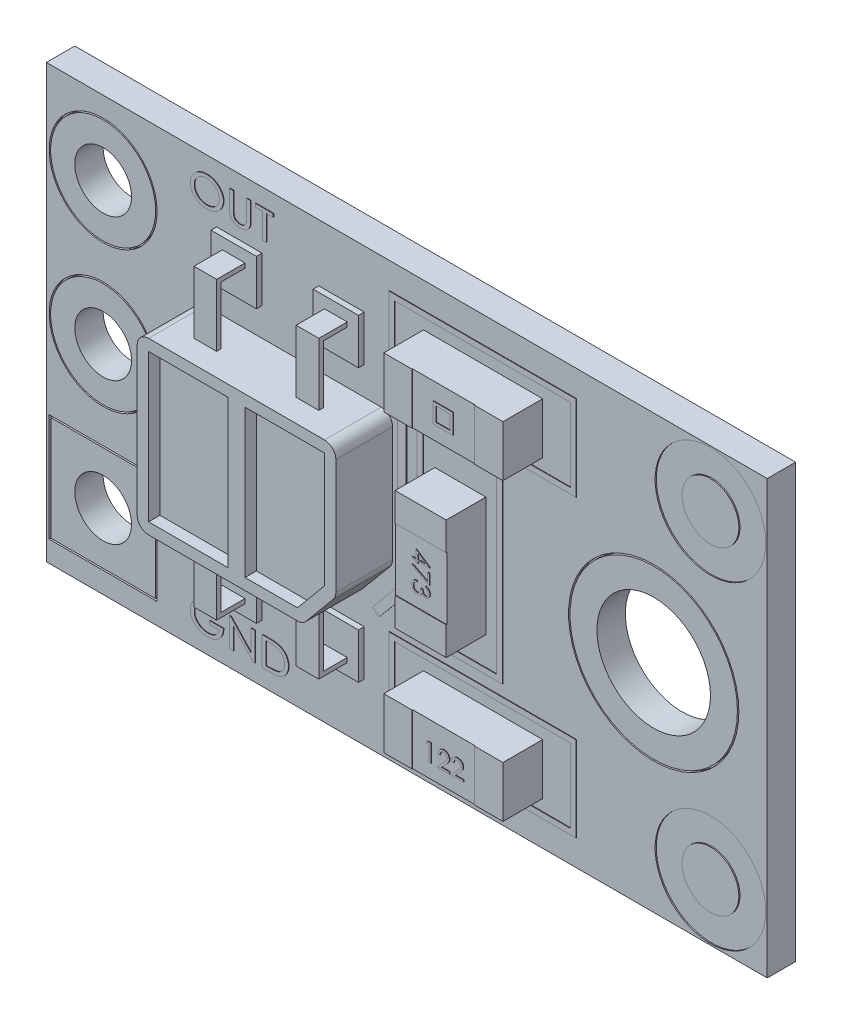
from build123d import *

# Parameters (mm, degrees)
CROQUIS1_W               = 12.7
CROQUIS1_H               = 7.62
SALIENTE_EXTRUIR1_DEPTH  = 0.25
CROQUIS2_R               = 0.95
CROQUIS2_R_2             = 0.925
CROQUIS2_W               = 1.9
CROQUIS2_H               = 1.9
CROQUIS2_W_2             = 1.84
CROQUIS2_H_2             = 1.84
CORTAR_EXTRUIR6_DEPTH    = 0.05
CROQUIS3_R               = 0.5
CORTAR_EXTRUIR7_DEPTH    = 50.05
CROQUIS4_R               = 1.5
CROQUIS4_R_2             = 1.475
CORTAR_EXTRUIR8_DEPTH    = 0.05
CROQUIS5_R               = 1
CORTAR_EXTRUIR9_DEPTH    = 40.05
CROQUIS6_R               = 0.975
CROQUIS6_R_2             = 0.5
CORTAR_EXTRUIR10_DEPTH   = 0.02
SALIENTE_EXTRUIR2_DEPTH  = 0.01
CROQUIS8_W               = 1.5
CROQUIS8_H               = 3.3
CROQUIS8_W_2             = 1.3
CROQUIS8_H_2             = 3.1
CROQUIS8_W_3             = 3.3
CROQUIS8_H_3             = 1.5
CROQUIS8_W_4             = 3.1
CROQUIS8_H_4             = 1.3
SALIENTE_EXTRUIR3_DEPTH  = 0.01
CROQUIS9_W               = 0.5
CROQUIS9_H               = 0.07051282
SALIENTE_EXTRUIR4_DEPTH  = 0.01
SALIENTE_EXTRUIR5_DEPTH  = 1
CROQUIS12_W              = 1.4
CROQUIS12_H              = 2.6
CORTAR_EXTRUIR11_DEPTH   = 0.2
CROQUIS13_W              = 0.8
CROQUIS13_H              = 0.8
SALIENTE_EXTRUIR6_DEPTH  = 0.1
CROQUIS14_W              = 0.4
CROQUIS14_H              = 1.1
SALIENTE_EXTRUIR7_DEPTH  = 0.5
CROQUIS15_W              = 0.42
CROQUIS15_H              = 1.02
CORTAR_EXTRUIR12_DEPTH   = 20.5
CORTAR_EXTRUIR13_DEPTH   = 11
SALIENTE_EXTRUIR8_DEPTH  = 0.01
CROQUIS18_W              = 2.1
CROQUIS18_H              = 0.9
CROQUIS18_W_2            = 0.9
CROQUIS18_H_2            = 2.1
SALIENTE_EXTRUIR9_DEPTH  = 0.7
CROQUIS19_W              = 1.1
CROQUIS19_H              = 0.9
CROQUIS19_W_2            = 0.9
CROQUIS19_H_2            = 1.1
CORTAR_EXTRUIR14_DEPTH   = 0.01
CROQUIS20_W              = 0.35
CROQUIS20_H              = 0.35
CROQUIS20_W_2            = 0.25
CROQUIS20_H_2            = 0.25
SALIENTE_EXTRUIR10_DEPTH = 0.01


with BuildPart() as part:
    # Croquis1 → Saliente-Extruir1 (new, symmetric)
    with BuildSketch(Plane.XY):
        Rectangle(CROQUIS1_W, CROQUIS1_H)
    extrude(amount=SALIENTE_EXTRUIR1_DEPTH, both=True)

    # Croquis2 → Cortar-Extruir6 (cut)
    # profile 1 of 3: a face of its own
    with BuildSketch(Plane.XY.offset(0.25)):
        with Locations((-5.35, 2.51)):
            Circle(CROQUIS2_R)
        with Locations((-5.35, 2.51)):
            Circle(CROQUIS2_R_2, mode=Mode.SUBTRACT)
    # profile 2 of 3: a face of its own
    with BuildSketch(Plane.XY.offset(0.25)):
        with Locations((-5.35, 0.01)):
            Circle(CROQUIS2_R)
        with Locations((-5.35, 0.01)):
            Circle(CROQUIS2_R_2, mode=Mode.SUBTRACT)
    # profile 3 of 3: a face of its own
    with BuildSketch(Plane.XY.offset(0.25)):
        with Locations((-5.35, -2.49)):
            Rectangle(CROQUIS2_W, CROQUIS2_H)
        with Locations((-5.35, -2.49)):
            Rectangle(CROQUIS2_W_2, CROQUIS2_H_2, mode=Mode.SUBTRACT)
    extrude(amount=-CORTAR_EXTRUIR6_DEPTH, mode=Mode.SUBTRACT)

    # Croquis3 → Cortar-Extruir7 (cut)
    with BuildSketch(Plane.XY.offset(0.25)):
        with Locations((-5.35, 2.51)):
            Circle(CROQUIS3_R)
        with Locations((-5.35, 0.01)):
            Circle(CROQUIS3_R)
        with Locations((-5.35, -2.49)):
            Circle(CROQUIS3_R)
    extrude(amount=-CORTAR_EXTRUIR7_DEPTH, mode=Mode.SUBTRACT)

    # Croquis4 → Cortar-Extruir8 (cut)
    with BuildSketch(Plane.XY.offset(0.25)):
        with Locations((4.35, 0)):
            Circle(CROQUIS4_R)
        with Locations((4.35, 0)):
            Circle(CROQUIS4_R_2, mode=Mode.SUBTRACT)
    extrude(amount=-CORTAR_EXTRUIR8_DEPTH, mode=Mode.SUBTRACT)

    # Croquis5 → Cortar-Extruir9 (cut)
    with BuildSketch(Plane.XY.offset(0.25)):
        with Locations((4.35, 0)):
            Circle(CROQUIS5_R)
    extrude(amount=-CORTAR_EXTRUIR9_DEPTH, mode=Mode.SUBTRACT)

    # Croquis6 → Cortar-Extruir10 (cut)
    # profile 1 of 2: a face of its own
    with BuildSketch(Plane.XY.offset(0.25)):
        with Locations((5.35, 2.81)):
            Circle(CROQUIS6_R)
        with Locations((5.35, 2.81)):
            Circle(CROQUIS6_R_2, mode=Mode.SUBTRACT)
    # profile 2 of 2: a face of its own
    with BuildSketch(Plane.XY.offset(0.25)):
        with Locations((5.35, -2.81)):
            Circle(CROQUIS6_R)
        with Locations((5.35, -2.81)):
            Circle(CROQUIS6_R_2, mode=Mode.SUBTRACT)
    extrude(amount=-CORTAR_EXTRUIR10_DEPTH, mode=Mode.SUBTRACT)

    # Croquis7 → Saliente-Extruir2 (add)
    # profile 1 of 6: a face of its own
    with BuildSketch(Plane.XY.offset(0.25)):
        with BuildLine():
            add(Edge.make_bspline(
                [(-3.520172276, 3.522820513), (-3.50971154, 3.522598173), (-3.489160024, 3.522161356), (-3.459031652, 3.518472078), (-3.430231343, 3.512494951), (-3.402761056, 3.504058656), (-3.376615169, 3.493227871), (-3.351848687, 3.479947049), (-3.328492632, 3.464208365), (-3.306723615, 3.446297148), (-3.286960401, 3.426706399), (-3.269421641, 3.406034569), (-3.25476033, 3.384158429), (-3.242579274, 3.361360499), (-3.233408402, 3.337427268), (-3.226603451, 3.312624136), (-3.222500209, 3.286746012), (-3.222032121, 3.269129296), (-3.221794872, 3.260200321)],
                knots=[0, 0, 0, 0, 1.133622203, 2.227152804, 3.28475862, 4.318496009, 5.33742298, 6.347804203, 7.359610414, 8.385564043, 9.398987128, 10.372561984, 11.319123818, 12.248396799, 13.168490851, 14.091228938, 15.032545622, 16, 16, 16, 16], degree=3))
            add(Edge.make_bspline(
                [(-3.221794872, 3.260200321), (-3.222029757, 3.251337084), (-3.222494027, 3.233818145), (-3.226651471, 3.208064917), (-3.233267753, 3.183251641), (-3.242514208, 3.159375085), (-3.254523639, 3.136503106), (-3.269296046, 3.114685908), (-3.28660546, 3.093793202), (-3.306323166, 3.074109304), (-3.327974371, 3.056129386), (-3.351071107, 3.040286787), (-3.375507428, 3.027027028), (-3.40112041, 3.016001054), (-3.428080221, 3.007676688), (-3.456172473, 3.001494424), (-3.485554041, 2.997847625), (-3.505572104, 2.997404914), (-3.515765224, 2.997179487)],
                knots=[0, 0, 0, 0, 0.968800078, 1.914915397, 2.844941176, 3.773252184, 4.70912315, 5.664138313, 6.649680364, 7.672140846, 8.70676723, 9.723611496, 10.730169601, 11.742789494, 12.768322859, 13.811145079, 14.885443574, 16, 16, 16, 16], degree=3))
            add(Edge.make_bspline(
                [(-3.515765224, 2.997179487), (-3.525724241, 2.997413848), (-3.545304747, 2.997874627), (-3.574084184, 3.001406533), (-3.601629768, 3.00743898), (-3.628009942, 3.015796861), (-3.653301132, 3.02638634), (-3.677291033, 3.03962559), (-3.700160992, 3.055105428), (-3.721503373, 3.072840425), (-3.741015174, 3.092187912), (-3.758160167, 3.112793702), (-3.772714212, 3.134448332), (-3.784594775, 3.157147083), (-3.793764068, 3.180921948), (-3.800393009, 3.205619194), (-3.804407624, 3.231389723), (-3.804885474, 3.248901232), (-3.805128205, 3.257796474)],
                knots=[0, 0, 0, 0, 1.102646875, 2.167923352, 3.20494899, 4.221049628, 5.228395391, 6.236046417, 7.250208059, 8.282166416, 9.304356202, 10.288974788, 11.245682606, 12.188277397, 13.119976628, 14.061642868, 15.015381414, 16, 16, 16, 16], degree=3))
            add(Edge.make_bspline(
                [(-3.805128205, 3.257796474), (-3.805014375, 3.263777111), (-3.804788735, 3.275632287), (-3.802931162, 3.293240191), (-3.799891156, 3.310490611), (-3.795864292, 3.327469908), (-3.790343559, 3.344018828), (-3.78388376, 3.360337456), (-3.77600699, 3.376215078), (-3.767147688, 3.391750533), (-3.757124641, 3.40658408), (-3.746307223, 3.420778205), (-3.734548661, 3.434120204), (-3.721931344, 3.446670338), (-3.708384605, 3.458290565), (-3.693956112, 3.469035927), (-3.678777501, 3.479071184), (-3.662741757, 3.488118586), (-3.646211421, 3.496376929), (-3.629122437, 3.503322609), (-3.611792545, 3.50938528), (-3.594094839, 3.514302776), (-3.57606239, 3.518117039), (-3.557691588, 3.520763819), (-3.539039348, 3.522592307), (-3.526486804, 3.522744136), (-3.520172276, 3.522820513)],
                knots=[0, 0, 0, 0, 0.994681255, 1.971716819, 2.941384761, 3.907196137, 4.87139339, 5.840822735, 6.824402777, 7.817050853, 8.813652822, 9.80005115, 10.783835005, 11.769545163, 12.758067534, 13.749969586, 14.760448599, 15.782717554, 16.810988271, 17.832034514, 18.848979272, 19.863616308, 20.885326922, 21.912667335, 22.949972225, 24, 24, 24, 24], degree=3))
        make_face()
        with BuildLine():
            add(Edge.make_bspline(
                [(-3.517768429, 3.465128205), (-3.522412525, 3.465061381), (-3.531652552, 3.464928426), (-3.545429057, 3.463542828), (-3.559041557, 3.46146065), (-3.572534025, 3.458560253), (-3.585834523, 3.454732508), (-3.598977877, 3.450118678), (-3.611965851, 3.444690575), (-3.624668433, 3.438422307), (-3.637003376, 3.431438793), (-3.648708119, 3.423690827), (-3.659844033, 3.415440669), (-3.670190695, 3.406436162), (-3.679965203, 3.39690823), (-3.689058006, 3.386693772), (-3.697528675, 3.375844567), (-3.705164615, 3.364360617), (-3.712149891, 3.352431115), (-3.718105194, 3.340012215), (-3.723273272, 3.327289857), (-3.727355639, 3.314136342), (-3.730694721, 3.300672647), (-3.732998401, 3.286775823), (-3.734281972, 3.272511061), (-3.734503354, 3.26287374), (-3.734615385, 3.257996795)],
                knots=[0, 0, 0, 0, 1.001886696, 1.99338304, 2.984853206, 3.972651636, 4.969239506, 5.969570638, 6.977140523, 8.005010729, 9.024666764, 10.033806776, 11.032397997, 12.013155796, 12.991369748, 13.976220934, 14.96199408, 15.959128717, 16.950206134, 17.942696722, 18.928733127, 19.910839666, 20.912130348, 21.920112307, 22.947477366, 24, 24, 24, 24], degree=3))
            add(Edge.make_bspline(
                [(-3.734615385, 3.257996795), (-3.734431743, 3.250840917), (-3.73407135, 3.236797695), (-3.730971625, 3.216220213), (-3.725983488, 3.196569954), (-3.718922735, 3.177828606), (-3.709868057, 3.159961463), (-3.698670805, 3.1431187), (-3.685544966, 3.127180243), (-3.670602405, 3.112404306), (-3.6543007, 3.098965944), (-3.636992754, 3.087238002), (-3.619032059, 3.077095592), (-3.600202778, 3.069003042), (-3.580661262, 3.062631931), (-3.560365426, 3.058165735), (-3.539314361, 3.055366958), (-3.525022212, 3.0550385), (-3.517768429, 3.054871795)],
                knots=[0, 0, 0, 0, 1.03727934, 2.035633217, 3.010330647, 3.972573882, 4.934000609, 5.908938527, 6.899607749, 7.923294137, 8.95177844, 9.958980979, 10.951742254, 11.938451676, 12.926051656, 13.928073702, 14.948422591, 16, 16, 16, 16], degree=3))
            add(Edge.make_bspline(
                [(-3.517768429, 3.054871795), (-3.51265703, 3.054937433), (-3.502517389, 3.05506764), (-3.487475347, 3.056455339), (-3.472710433, 3.058488805), (-3.458294702, 3.061581363), (-3.444064937, 3.065209576), (-3.430207942, 3.069954736), (-3.416637625, 3.075486417), (-3.403429882, 3.081752536), (-3.390760614, 3.088884641), (-3.378648739, 3.09654864), (-3.367251324, 3.104856042), (-3.356776214, 3.113973731), (-3.346757974, 3.12342389), (-3.337669287, 3.133712971), (-3.329224504, 3.144542491), (-3.321529628, 3.155953761), (-3.314606658, 3.167804065), (-3.308735862, 3.180109199), (-3.303528435, 3.192632527), (-3.299489479, 3.205560506), (-3.296241595, 3.218768392), (-3.293918863, 3.232320021), (-3.29264908, 3.246220296), (-3.292421888, 3.255590594), (-3.292307692, 3.260300481)],
                knots=[0, 0, 0, 0, 1.081838315, 2.146076261, 3.195683593, 4.235390777, 5.265781704, 6.302938874, 7.333329801, 8.367181877, 9.395631416, 10.409402045, 11.400444419, 12.377959082, 13.347802418, 14.314007038, 15.281116162, 16.253506205, 17.225819172, 18.183714434, 19.137977778, 20.09475097, 21.047940386, 22.015927363, 23.002725858, 24, 24, 24, 24], degree=3))
            add(Edge.make_bspline(
                [(-3.292307692, 3.260300481), (-3.292421537, 3.264976911), (-3.292647216, 3.27424719), (-3.293912646, 3.287983114), (-3.296275307, 3.301391298), (-3.299432116, 3.314457614), (-3.303578389, 3.327219105), (-3.308708834, 3.339569911), (-3.314607708, 3.351700345), (-3.321566679, 3.363356931), (-3.32918735, 3.374679387), (-3.33779777, 3.385306825), (-3.347029848, 3.39543704), (-3.356910349, 3.405108018), (-3.367731652, 3.414019929), (-3.379227924, 3.42242733), (-3.391492974, 3.430276639), (-3.404439295, 3.437401461), (-3.417835446, 3.44390773), (-3.431483789, 3.449650234), (-3.445421546, 3.454287684), (-3.459439746, 3.458428126), (-3.473765956, 3.461326817), (-3.488262665, 3.463591301), (-3.502953155, 3.464914359), (-3.512824658, 3.465056846), (-3.517768429, 3.465128205)],
                knots=[0, 0, 0, 0, 0.994155032, 1.970754174, 2.928608866, 3.885595639, 4.825912961, 5.777410987, 6.726365038, 7.690299412, 8.660690635, 9.624912318, 10.594446844, 11.573080812, 12.560755883, 13.571390023, 14.598998756, 15.653599689, 16.710514158, 17.763538028, 18.798106891, 19.831384962, 20.868287771, 21.902053123, 22.949322197, 24, 24, 24, 24], degree=3))
        make_face(mode=Mode.SUBTRACT)
    # profile 2 of 6: a face of its own
    with BuildSketch(Plane.XY.offset(0.25)):
        with BuildLine():
            Line((-3.112820513, 3.51), (-3.042307692, 3.51))
            Line((-3.042307692, 3.51), (-3.042307692, 3.208116987))
            add(Edge.make_bspline(
                [(-3.042307692, 3.208116987), (-3.04231412, 3.203943659), (-3.042326359, 3.195997494), (-3.042244696, 3.184745136), (-3.042004533, 3.174763739), (-3.041855848, 3.16604722), (-3.041527483, 3.158603143), (-3.041252621, 3.152423929), (-3.040909453, 3.147537959), (-3.040484931, 3.144713965), (-3.040304487, 3.143513622)],
                knots=[0, 0, 0, 0, 1.548731127, 2.948838887, 4.175684214, 5.253885865, 6.183867635, 6.940561878, 7.549683953, 8, 8, 8, 8], degree=3))
            add(Edge.make_bspline(
                [(-3.040304487, 3.143513622), (-3.039556638, 3.138845524), (-3.038116301, 3.129854888), (-3.034087212, 3.117256574), (-3.029188695, 3.105928095), (-3.022819106, 3.095969631), (-3.015013741, 3.087113314), (-3.005482179, 3.079378002), (-2.994427043, 3.072258665), (-2.981868317, 3.066253509), (-2.968539853, 3.061204128), (-2.954879114, 3.057587805), (-2.941226326, 3.055256339), (-2.932073784, 3.05499948), (-2.927524038, 3.054871795)],
                knots=[0, 0, 0, 0, 1.076166962, 2.072670033, 3.006093884, 3.882195196, 4.755615117, 5.685184141, 6.671023493, 7.746544464, 8.851914234, 9.915195746, 10.96363998, 12, 12, 12, 12], degree=3))
            add(Edge.make_bspline(
                [(-2.927524038, 3.054871795), (-2.923311954, 3.054990611), (-2.914915939, 3.055227448), (-2.902476677, 3.057031439), (-2.890378278, 3.060244091), (-2.87857799, 3.064343944), (-2.867489849, 3.069763449), (-2.857129596, 3.075979173), (-2.84780388, 3.083190711), (-2.839477007, 3.091383097), (-2.832279796, 3.100596818), (-2.825889868, 3.110591748), (-2.820782726, 3.121653518), (-2.818176251, 3.129430961), (-2.816846955, 3.133397436)],
                knots=[0, 0, 0, 0, 1.03890084, 2.070857692, 3.091612554, 4.123174951, 5.147213858, 6.130293416, 7.098950148, 8.048226128, 9.003911397, 9.977318186, 10.968437602, 12, 12, 12, 12], degree=3))
            add(Edge.make_bspline(
                [(-2.816846955, 3.133397436), (-2.816428377, 3.135096183), (-2.81550673, 3.138836572), (-2.814413305, 3.145121869), (-2.813573244, 3.152651179), (-2.812758498, 3.161397554), (-2.812181881, 3.17135247), (-2.811784642, 3.182506308), (-2.811618845, 3.194895372), (-2.811566067, 3.203576377), (-2.811538462, 3.208116987)],
                knots=[0, 0, 0, 0, 0.55920234, 1.231279909, 2.037518699, 2.980640334, 4.039233634, 5.224736444, 6.548395006, 8, 8, 8, 8], degree=3))
            Line((-2.811538462, 3.208116987), (-2.811538462, 3.51))
            Line((-2.811538462, 3.51), (-2.741025641, 3.51))
            Line((-2.741025641, 3.51), (-2.741025641, 3.20911859))
            add(Edge.make_bspline(
                [(-2.741025641, 3.20911859), (-2.741051686, 3.203809073), (-2.741102489, 3.193452169), (-2.74185833, 3.178290136), (-2.742901807, 3.163851758), (-2.744518438, 3.150157043), (-2.746522277, 3.137194587), (-2.74887216, 3.124976187), (-2.751794235, 3.113509338), (-2.755188482, 3.102675461), (-2.759318342, 3.092334078), (-2.764360862, 3.082391086), (-2.770288277, 3.072718137), (-2.777240067, 3.063379453), (-2.785185802, 3.054377035), (-2.794065513, 3.045623078), (-2.803848526, 3.037133542), (-2.814543023, 3.029053402), (-2.825975214, 3.021512583), (-2.838233586, 3.015022886), (-2.851096237, 3.00949516), (-2.864594653, 3.004967611), (-2.878734532, 3.001479726), (-2.89349888, 2.99899473), (-2.908894703, 2.997451199), (-2.919373979, 2.99727127), (-2.924719551, 2.997179487)],
                knots=[0, 0, 0, 0, 1.193167898, 2.327429379, 3.411096762, 4.44607785, 5.425607575, 6.358592928, 7.241248063, 8.083692965, 8.908577969, 9.740802074, 10.586315759, 11.455245116, 12.353831429, 13.282370586, 14.25578828, 15.262782408, 16.292992402, 17.33025582, 18.37562974, 19.436295847, 20.526412686, 21.645280761, 22.7988368, 24, 24, 24, 24], degree=3))
            add(Edge.make_bspline(
                [(-2.924719551, 2.997179487), (-2.930163712, 2.997290435), (-2.940833836, 2.997507885), (-2.956566993, 2.998782742), (-2.971714445, 3.001117343), (-2.986317542, 3.00427343), (-3.000328261, 3.008431153), (-3.013794305, 3.013386412), (-3.026598431, 3.019461357), (-3.038826858, 3.026213037), (-3.050198925, 3.033808633), (-3.060700974, 3.042059366), (-3.070197233, 3.050931025), (-3.078673059, 3.060445453), (-3.086242266, 3.070460337), (-3.092731693, 3.08116443), (-3.098464798, 3.092357891), (-3.10128715, 3.100275275), (-3.102704327, 3.104250801)],
                knots=[0, 0, 0, 0, 1.176733592, 2.306304952, 3.408462524, 4.48698178, 5.532704747, 6.564745095, 7.584809351, 8.592651907, 9.581299679, 10.536954629, 11.476288365, 12.385941033, 13.287919837, 14.18515257, 15.088717462, 16, 16, 16, 16], degree=3))
            add(Edge.make_bspline(
                [(-3.102704327, 3.104250801), (-3.10355487, 3.10694238), (-3.105382829, 3.112727031), (-3.107225109, 3.122315608), (-3.109107667, 3.133250714), (-3.110415263, 3.145666463), (-3.111510777, 3.159492531), (-3.112327712, 3.174754876), (-3.112657571, 3.191455601), (-3.112764765, 3.20307554), (-3.112820513, 3.20911859)],
                knots=[0, 0, 0, 0, 0.640288176, 1.376085685, 2.213396162, 3.15917552, 4.208408772, 5.362026459, 6.628099167, 8, 8, 8, 8], degree=3))
            Line((-3.112820513, 3.20911859), (-3.112820513, 3.51))
        make_face()
    # profile 3 of 6: a face of its own
    with BuildSketch(Plane.XY.offset(0.25)):
        Polygon((-2.657692308, 3.452307692), (-2.657692308, 3.51), (-2.343589744, 3.51), (-2.343589744, 3.452307692), (-2.465384615, 3.452307692), (-2.465384615, 3.01), (-2.535897436, 3.01), (-2.535897436, 3.452307692), align=None)
    # profile 4 of 6: a face of its own
    with BuildSketch(Plane.XY.offset(0.25)):
        with BuildLine():
            Line((-3.253846154, -3.0959375), (-3.306730769, -3.138205128))
            add(Edge.make_bspline(
                [(-3.306730769, -3.138205128), (-3.314936887, -3.131518135), (-3.331021971, -3.118410739), (-3.356494954, -3.101561215), (-3.382104458, -3.08704489), (-3.407999956, -3.075417047), (-3.433763477, -3.06616041), (-3.459277083, -3.059818266), (-3.48437754, -3.055634326), (-3.50102577, -3.055124029), (-3.509254808, -3.054871795)],
                knots=[0, 0, 0, 0, 1.136479573, 2.227651402, 3.276167318, 4.295422796, 5.273200386, 6.212616602, 7.116515995, 8, 8, 8, 8], degree=3))
            add(Edge.make_bspline(
                [(-3.509254808, -3.054871795), (-3.514099002, -3.054939179), (-3.52373845, -3.055073267), (-3.538083327, -3.056447694), (-3.552258981, -3.058551148), (-3.566320796, -3.061434465), (-3.580217311, -3.065274321), (-3.593988769, -3.06985155), (-3.607528543, -3.075431433), (-3.620859242, -3.081665196), (-3.633783559, -3.088666328), (-3.646065006, -3.096352365), (-3.657658548, -3.104658342), (-3.668382696, -3.11376205), (-3.6785176, -3.123358777), (-3.687986708, -3.133578885), (-3.696615675, -3.144560811), (-3.70446967, -3.156132281), (-3.711554131, -3.168062223), (-3.717711921, -3.180276131), (-3.722931829, -3.192650191), (-3.727118822, -3.205296216), (-3.730619825, -3.218072003), (-3.732841692, -3.231160273), (-3.734313539, -3.244408154), (-3.73451443, -3.253318641), (-3.734615385, -3.257796474)],
                knots=[0, 0, 0, 0, 1.036121697, 2.061775624, 3.080040594, 4.10128255, 5.130586283, 6.162859881, 7.204114754, 8.261777922, 9.310138086, 10.346678264, 11.359718751, 12.358429797, 13.353763351, 14.344549927, 15.336288725, 16.338773123, 17.334721619, 18.302637401, 19.263091895, 20.205013771, 21.151016468, 22.094021076, 23.042178679, 24, 24, 24, 24], degree=3))
            add(Edge.make_bspline(
                [(-3.734615385, -3.257796474), (-3.734519408, -3.262407793), (-3.734328333, -3.271588158), (-3.732784194, -3.285217609), (-3.730257208, -3.298636377), (-3.726781395, -3.311840968), (-3.722202465, -3.324794068), (-3.71682656, -3.337595781), (-3.710256849, -3.350112753), (-3.702789803, -3.362353235), (-3.694487323, -3.374187663), (-3.685401051, -3.385350393), (-3.675615078, -3.395880027), (-3.665064081, -3.405626641), (-3.653984819, -3.414958495), (-3.641977366, -3.423280237), (-3.629443518, -3.431193032), (-3.616163793, -3.438235119), (-3.602369515, -3.444521476), (-3.588194243, -3.450043122), (-3.573709413, -3.454811483), (-3.55883871, -3.458401942), (-3.543761281, -3.461523479), (-3.528294592, -3.463548646), (-3.512518564, -3.464928818), (-3.501879368, -3.465061532), (-3.496534455, -3.465128205)],
                knots=[0, 0, 0, 0, 0.945893625, 1.883116459, 2.810095563, 3.745514405, 4.681359504, 5.626657697, 6.591727206, 7.578527444, 8.566729337, 9.555216069, 10.529358823, 11.513182855, 12.500719804, 13.498466567, 14.507715383, 15.54042461, 16.579542825, 17.616242512, 18.660338271, 19.705309959, 20.753128956, 21.817761749, 22.903688432, 24, 24, 24, 24], degree=3))
            add(Edge.make_bspline(
                [(-3.496534455, -3.465128205), (-3.489851588, -3.464992677), (-3.476722403, -3.464726417), (-3.457444952, -3.462656227), (-3.43889288, -3.459436113), (-3.421236866, -3.454579395), (-3.404318509, -3.448573404), (-3.38828571, -3.441120574), (-3.372958785, -3.432407757), (-3.358676139, -3.422289534), (-3.345396272, -3.411393731), (-3.333524184, -3.399676074), (-3.322938037, -3.38748957), (-3.313883474, -3.374630492), (-3.306363448, -3.361199001), (-3.300039494, -3.347311763), (-3.295312596, -3.332748855), (-3.293311855, -3.322723825), (-3.292307692, -3.317692308)],
                knots=[0, 0, 0, 0, 1.171272947, 2.301087098, 3.395181503, 4.46854069, 5.507124884, 6.538875723, 7.563914752, 8.593355544, 9.603515705, 10.571969702, 11.514049303, 12.429855251, 13.323511858, 14.208966251, 15.101088287, 16, 16, 16, 16], degree=3))
            Line((-3.292307692, -3.317692308), (-3.465384615, -3.317692308))
            Line((-3.465384615, -3.317692308), (-3.465384615, -3.26))
            Line((-3.465384615, -3.26), (-3.221794872, -3.26))
            add(Edge.make_bspline(
                [(-3.221794872, -3.26), (-3.22204652, -3.269894842), (-3.222538894, -3.289255053), (-3.226334009, -3.317448431), (-3.232293604, -3.34405739), (-3.240627896, -3.369037381), (-3.251259342, -3.392453392), (-3.264374209, -3.414200825), (-3.27979303, -3.434354495), (-3.297440647, -3.452780866), (-3.317065231, -3.469279871), (-3.33838861, -3.483707415), (-3.361440265, -3.495758264), (-3.386061229, -3.505693565), (-3.412364967, -3.513415023), (-3.440295306, -3.518852312), (-3.469842356, -3.522227911), (-3.490081525, -3.522619885), (-3.500440705, -3.522820513)],
                knots=[0, 0, 0, 0, 1.097113904, 2.146609077, 3.149102886, 4.117486404, 5.061979074, 5.995490935, 6.927922601, 7.870758851, 8.81945941, 9.766366118, 10.720420808, 11.698896732, 12.706533703, 13.755891687, 14.85137968, 16, 16, 16, 16], degree=3))
            add(Edge.make_bspline(
                [(-3.500440705, -3.522820513), (-3.506585575, -3.522738067), (-3.518751521, -3.522574836), (-3.536728295, -3.521443836), (-3.554248151, -3.519679309), (-3.571254186, -3.517054546), (-3.58779946, -3.513756696), (-3.603892219, -3.509761874), (-3.619466293, -3.504959725), (-3.634587311, -3.499432231), (-3.649168073, -3.493146033), (-3.663255192, -3.486079352), (-3.676874769, -3.478380375), (-3.690053778, -3.4699715), (-3.702660495, -3.460686017), (-3.714921779, -3.450830875), (-3.726555567, -3.440046075), (-3.73391654, -3.432411185), (-3.737620192, -3.428569712)],
                knots=[0, 0, 0, 0, 1.121509803, 2.220426063, 3.286392098, 4.334370597, 5.359746879, 6.364749295, 7.359352293, 8.332918586, 9.301897068, 10.255715467, 11.208072822, 12.156366433, 13.107065222, 14.064478, 15.026147687, 16, 16, 16, 16], degree=3))
            add(Edge.make_bspline(
                [(-3.737620192, -3.428569712), (-3.743016274, -3.422491017), (-3.753661903, -3.410498701), (-3.767342646, -3.391036591), (-3.779087766, -3.370979475), (-3.788503594, -3.350095911), (-3.795981889, -3.328589498), (-3.801321307, -3.306321329), (-3.8044564, -3.283293446), (-3.804902625, -3.26768845), (-3.805128205, -3.259799679)],
                knots=[0, 0, 0, 0, 1.046645722, 2.064868952, 3.059535313, 4.037586224, 5.011721635, 5.989441332, 6.983605171, 8, 8, 8, 8], degree=3))
            add(Edge.make_bspline(
                [(-3.805128205, -3.259799679), (-3.805012803, -3.25391911), (-3.804782768, -3.242197165), (-3.802929577, -3.224790741), (-3.799926799, -3.207687338), (-3.795718591, -3.190947012), (-3.790283068, -3.174500784), (-3.783548482, -3.158432529), (-3.775713915, -3.142624625), (-3.766700174, -3.127239343), (-3.75666569, -3.112387481), (-3.745585402, -3.098327645), (-3.733682579, -3.085065293), (-3.72079207, -3.07276185), (-3.707137155, -3.061141321), (-3.692482619, -3.050492662), (-3.677031246, -3.040475303), (-3.660608461, -3.031552195), (-3.643547233, -3.023430771), (-3.625854008, -3.016382783), (-3.607594285, -3.0105276), (-3.588863212, -3.005544135), (-3.569567453, -3.001902994), (-3.549778195, -2.999208229), (-3.529453669, -2.997407245), (-3.515702312, -2.997255939), (-3.508754006, -2.997179487)],
                knots=[0, 0, 0, 0, 0.958902626, 1.911414358, 2.851392495, 3.789049363, 4.724046296, 5.673596279, 6.628175768, 7.599428848, 8.579585585, 9.549066472, 10.516787238, 11.483404386, 12.453206341, 13.43883814, 14.435716549, 15.454352088, 16.484651055, 17.516014247, 18.557803387, 19.610422301, 20.675126112, 21.757848131, 22.867082209, 24, 24, 24, 24], degree=3))
            add(Edge.make_bspline(
                [(-3.508754006, -2.997179487), (-3.502943691, -2.997274571), (-3.491381666, -2.997463779), (-3.474163941, -2.998426974), (-3.45719263, -3.000266794), (-3.440484129, -3.002763696), (-3.424021967, -3.005927618), (-3.407913137, -3.010005422), (-3.392004472, -3.014565364), (-3.376340815, -3.020023332), (-3.360780874, -3.02622873), (-3.34530848, -3.033333781), (-3.329966262, -3.041548656), (-3.314572112, -3.05047873), (-3.299272585, -3.060503515), (-3.283997588, -3.071387505), (-3.268743252, -3.08319779), (-3.258853135, -3.091655627), (-3.253846154, -3.0959375)],
                knots=[0, 0, 0, 0, 0.996406933, 1.982763586, 2.955754877, 3.922477405, 4.879077619, 5.828817931, 6.770918133, 7.716005497, 8.671731627, 9.642564683, 10.63366163, 11.654825771, 12.693319108, 13.76878984, 14.870425269, 16, 16, 16, 16], degree=3))
        make_face()
    # profile 5 of 6: a face of its own
    with BuildSketch(Plane.XY.offset(0.25)):
        Polygon((-3.112820513, -3.51), (-3.112820513, -3.01), (-3.088481571, -3.01), (-2.734615385, -3.387303686), (-2.734615385, -3.01), (-2.664102564, -3.01), (-2.664102564, -3.51), (-2.691346154, -3.51), (-3.042307692, -3.133697917), (-3.042307692, -3.51), align=None)
    # profile 6 of 6: a face of its own
    with BuildSketch(Plane.XY.offset(0.25)):
        with BuildLine():
            Line((-2.542307692, -3.51), (-2.542307692, -3.01))
            Line((-2.542307692, -3.01), (-2.425420673, -3.01))
            add(Edge.make_bspline(
                [(-2.425420673, -3.01), (-2.415604452, -3.010063299), (-2.396636358, -3.010185614), (-2.36925017, -3.010958597), (-2.343930077, -3.012326821), (-2.320720207, -3.014338721), (-2.29955436, -3.0167527), (-2.280518425, -3.019887661), (-2.263512065, -3.02332635), (-2.25305993, -3.026455072), (-2.248137019, -3.027928686)],
                knots=[0, 0, 0, 0, 1.317711811, 2.546242739, 3.67739278, 4.721022107, 5.673292184, 6.536090057, 7.310504749, 8, 8, 8, 8], degree=3))
            add(Edge.make_bspline(
                [(-2.248137019, -3.027928686), (-2.241323896, -3.030271912), (-2.227892061, -3.0348915), (-2.208673265, -3.043330658), (-2.1906305, -3.052854942), (-2.173871869, -3.063570957), (-2.158378427, -3.075490303), (-2.143966575, -3.088380047), (-2.130933916, -3.102596397), (-2.119122385, -3.117814165), (-2.10859891, -3.133927666), (-2.099513843, -3.150818137), (-2.091574027, -3.168297431), (-2.085334316, -3.186569545), (-2.080383454, -3.205481369), (-2.076910997, -3.225074662), (-2.074746148, -3.245361118), (-2.074489284, -3.25912645), (-2.074358974, -3.266109776)],
                knots=[0, 0, 0, 0, 1.089443093, 2.147799292, 3.171190999, 4.172819861, 5.152592934, 6.125181386, 7.093710006, 8.065485224, 9.036183828, 10.001071747, 10.964041463, 11.936669248, 12.917807949, 13.918315851, 14.943935532, 16, 16, 16, 16], degree=3))
            add(Edge.make_bspline(
                [(-2.074358974, -3.266109776), (-2.074488843, -3.272155932), (-2.07474473, -3.284068978), (-2.076343876, -3.30171246), (-2.079146063, -3.318811638), (-2.083081948, -3.33543915), (-2.088057931, -3.351553414), (-2.094206117, -3.36714538), (-2.101431624, -3.382211224), (-2.109734823, -3.396683591), (-2.118925405, -3.410453457), (-2.128846321, -3.423446972), (-2.139592195, -3.435468953), (-2.151036306, -3.44661451), (-2.163149921, -3.45687643), (-2.176071995, -3.466086754), (-2.189611747, -3.474562951), (-2.204034585, -3.482111052), (-2.219539072, -3.488823423), (-2.236376549, -3.494464309), (-2.254622343, -3.499249187), (-2.274238363, -3.503278934), (-2.295325397, -3.506192018), (-2.317779615, -3.508366457), (-2.341633767, -3.509841672), (-2.358010508, -3.509946256), (-2.366426282, -3.51)],
                knots=[0, 0, 0, 0, 1.007981188, 1.986076201, 2.950519889, 3.894198426, 4.832527221, 5.759646385, 6.685729118, 7.615650865, 8.538785137, 9.443855862, 10.338720281, 11.224328192, 12.105165873, 12.982532451, 13.867510485, 14.766261093, 15.69369764, 16.681123366, 17.723374289, 18.83677682, 20.017482422, 21.270242657, 22.59721662, 24, 24, 24, 24], degree=3))
            Line((-2.366426282, -3.51), (-2.542307692, -3.51))
        make_face()
        with BuildLine():
            Line((-2.471794872, -3.452307692), (-2.422616186, -3.452307692))
            add(Edge.make_bspline(
                [(-2.422616186, -3.452307692), (-2.413768101, -3.452277347), (-2.396804247, -3.452219168), (-2.372398253, -3.451557272), (-2.350114574, -3.450779741), (-2.329985813, -3.449305359), (-2.311992057, -3.447733538), (-2.296173426, -3.445465545), (-2.282390425, -3.443124173), (-2.274033046, -3.440910464), (-2.270172276, -3.439887821)],
                knots=[0, 0, 0, 0, 1.384834661, 2.655052778, 3.821319688, 4.874218543, 5.81381752, 6.64743442, 7.375169614, 8, 8, 8, 8], degree=3))
            add(Edge.make_bspline(
                [(-2.270172276, -3.439887821), (-2.265406401, -3.438354572), (-2.256022895, -3.435335766), (-2.242533786, -3.429661823), (-2.229798635, -3.423207328), (-2.217901561, -3.4157143), (-2.206786296, -3.40740276), (-2.196395623, -3.398261784), (-2.186887492, -3.388203832), (-2.178139836, -3.377379792), (-2.170322045, -3.365754993), (-2.163521423, -3.353406271), (-2.157677342, -3.340461015), (-2.152943081, -3.326855074), (-2.149376588, -3.31259696), (-2.146782916, -3.297701984), (-2.145121425, -3.282173099), (-2.14495592, -3.27158948), (-2.144871795, -3.266209936)],
                knots=[0, 0, 0, 0, 1.039072906, 2.045825353, 3.034808061, 4.000335628, 4.961123462, 5.913875292, 6.870025548, 7.831388383, 8.800393549, 9.774665826, 10.755133074, 11.746057439, 12.761554502, 13.803214009, 14.88339641, 16, 16, 16, 16], degree=3))
            add(Edge.make_bspline(
                [(-2.144871795, -3.266209936), (-2.144988364, -3.260562844), (-2.145217216, -3.249476268), (-2.146989597, -3.233145127), (-2.149719216, -3.217420635), (-2.153751202, -3.202352311), (-2.15891325, -3.187932899), (-2.165066861, -3.174073745), (-2.172562968, -3.160917426), (-2.181044376, -3.148402992), (-2.190573336, -3.136685579), (-2.200995142, -3.125828634), (-2.212360173, -3.115971038), (-2.224660138, -3.107141369), (-2.237780453, -3.09921495), (-2.25182963, -3.092285213), (-2.266742505, -3.086217708), (-2.277187794, -3.08309842), (-2.282491987, -3.081514423)],
                knots=[0, 0, 0, 0, 1.088113395, 2.136223958, 3.162378365, 4.161279348, 5.138177715, 6.111637112, 7.079744099, 8.052395062, 9.022147165, 9.986891134, 10.949336378, 11.917250896, 12.901580182, 13.900108062, 14.933659721, 16, 16, 16, 16], degree=3))
            add(Edge.make_bspline(
                [(-2.282491987, -3.081514423), (-2.286954605, -3.080394937), (-2.296487417, -3.078003548), (-2.311987443, -3.075296438), (-2.329496235, -3.072921894), (-2.34903661, -3.070929527), (-2.370582738, -3.069446538), (-2.394131817, -3.068538124), (-2.419706462, -3.06775585), (-2.437439188, -3.067714037), (-2.446654647, -3.067692308)],
                knots=[0, 0, 0, 0, 0.668454952, 1.427918762, 2.284972982, 3.236083489, 4.281807067, 5.423067478, 6.660802823, 8, 8, 8, 8], degree=3))
            Line((-2.446654647, -3.067692308), (-2.471794872, -3.067692308))
            Line((-2.471794872, -3.067692308), (-2.471794872, -3.452307692))
        make_face(mode=Mode.SUBTRACT)
    extrude(amount=SALIENTE_EXTRUIR2_DEPTH)

    # Croquis8 → Saliente-Extruir3 (add)
    # profile 1 of 3: a face of its own
    with BuildSketch(Plane.XY.offset(0.25)):
        with Locations((0.943826491, 0)):
            Rectangle(CROQUIS8_W, CROQUIS8_H)
        with Locations((0.943826491, 0)):
            Rectangle(CROQUIS8_W_2, CROQUIS8_H_2, mode=Mode.SUBTRACT)
    # profile 2 of 3: a face of its own
    with BuildSketch(Plane.XY.offset(0.25)):
        with Locations((1.343826491, 2.6)):
            Rectangle(CROQUIS8_W_3, CROQUIS8_H_3)
        with Locations((1.343826491, 2.6)):
            Rectangle(CROQUIS8_W_4, CROQUIS8_H_4, mode=Mode.SUBTRACT)
    # profile 3 of 3: a face of its own
    with BuildSketch(Plane.XY.offset(0.25)):
        with Locations((1.343826491, -2.6)):
            Rectangle(CROQUIS8_W_3, CROQUIS8_H_3)
        with Locations((1.343826491, -2.6)):
            Rectangle(CROQUIS8_W_4, CROQUIS8_H_4, mode=Mode.SUBTRACT)
    extrude(amount=SALIENTE_EXTRUIR3_DEPTH)

    # Croquis9 → Saliente-Extruir4 (add)
    with BuildSketch(Plane.XY.offset(0.25)):
        Polygon((-3.8, 0.638275536), (-3.8, 0.566260312), (-4.17880609, 0.388576017), (-3.8, 0.211092043), (-3.8, 0.138275536), (-4.3, 0.378559991), (-4.3, 0.398792363), align=None)
        with Locations((-4.05, 0.013275536)):
            Rectangle(CROQUIS9_W, CROQUIS9_H)
        Polygon((-4.3, -0.130955233), (-3.8, -0.130955233), (-3.8, -0.155194015), (-4.179306891, -0.515570618), (-3.8, -0.515570618), (-3.8, -0.586083438), (-4.3, -0.586083438), (-4.3, -0.558839848), (-3.921694712, -0.201468054), (-4.3, -0.201468054), align=None)
    extrude(amount=SALIENTE_EXTRUIR4_DEPTH)

    # Croquis11 → Saliente-Extruir5 (add)
    with BuildSketch(Plane.XY.offset(0.25)):
        with BuildLine():
            Line((-3.75, -1.3), (-3.75, 1.3))
            ThreePointArc((-3.75, 1.3), (-3.691421356, 1.441421356), (-3.55, 1.5))
            Line((-3.55, 1.5), (-0.45, 1.5))
            ThreePointArc((-0.45, 1.5), (-0.308578644, 1.441421356), (-0.25, 1.3))
            Line((-0.25, 1.3), (-0.25, -0.72758188))
            ThreePointArc((-0.25, -0.72758188), (-0.261948132, -0.795673694), (-0.296364951, -0.855629807))
            Line((-0.296364951, -0.855629807), (-0.7734498, -1.428047928))
            ThreePointArc((-0.7734498, -1.428047928), (-0.842260282, -1.481120934), (-0.927084849, -1.5))
            Line((-0.927084849, -1.5), (-3.55, -1.5))
            ThreePointArc((-3.55, -1.5), (-3.691421356, -1.441421356), (-3.75, -1.3))
        make_face()
    extrude(amount=SALIENTE_EXTRUIR5_DEPTH)

    # Croquis12 → Cortar-Extruir11 (cut)
    with BuildSketch(Plane.XY.offset(1.25)):
        with Locations((-2.85, 0)):
            Rectangle(CROQUIS12_W, CROQUIS12_H)
        Polygon((-0.45, 1.3), (-0.45, -0.72758188), (-0.927084849, -1.3), (-1.85, -1.3), (-1.85, 1.3), align=None)
    extrude(amount=-CORTAR_EXTRUIR11_DEPTH, mode=Mode.SUBTRACT)

    # Croquis13 → Saliente-Extruir6 (add)
    with BuildSketch(Plane.XY.offset(0.25)):
        with Locations((-2.95, 2.4)):
            Rectangle(CROQUIS13_W, CROQUIS13_H)
        with Locations((-1.15, 2.4)):
            Rectangle(CROQUIS13_W, CROQUIS13_H)
        with Locations((-2.95, -2.4)):
            Rectangle(CROQUIS13_W, CROQUIS13_H)
        with Locations((-1.15, -2.4)):
            Rectangle(CROQUIS13_W, CROQUIS13_H)
    extrude(amount=SALIENTE_EXTRUIR6_DEPTH)

    # Croquis14 → Saliente-Extruir7 (add)
    with BuildSketch(Plane.XY.offset(0.35)):
        with Locations((-2.95, -2.05)):
            Rectangle(CROQUIS14_W, CROQUIS14_H)
        with Locations((-1.15, -2.05)):
            Rectangle(CROQUIS14_W, CROQUIS14_H)
        with Locations((-2.95, 2.05)):
            Rectangle(CROQUIS14_W, CROQUIS14_H)
        with Locations((-1.15, 2.05)):
            Rectangle(CROQUIS14_W, CROQUIS14_H)
    extrude(amount=SALIENTE_EXTRUIR7_DEPTH)

    # Croquis15 → Cortar-Extruir12 (cut)
    with BuildSketch(Plane(origin=(-0.95, 0, 0), x_dir=(0, 0, -1), z_dir=(1, 0, 0))):
        with Locations((-0.56, -2.01)):
            Rectangle(CROQUIS15_W, CROQUIS15_H)
    extrude(amount=-CORTAR_EXTRUIR12_DEPTH, mode=Mode.SUBTRACT)

    # Croquis16 → Cortar-Extruir13 (cut)
    with BuildSketch(Plane(origin=(-0.95, 0, 0), x_dir=(0, 0, -1), z_dir=(1, 0, 0))):
        Polygon((-0.77, 2.52), (-0.77, 1.5), (-0.35, 1.5), (-0.35, 2), (-0.35, 2.52), align=None)
    extrude(amount=-CORTAR_EXTRUIR13_DEPTH, mode=Mode.SUBTRACT)

    # Croquis17 → Saliente-Extruir8 (add)
    with BuildSketch(Plane.XY.offset(0.25)):
        Polygon((-0.593596318, -1.615902068), (-0.15, -1.08366431), (-0.15, 1.65), (0, 1.65), (0, -1.1379779), (-0.478370032, -1.711938014), align=None)
    extrude(amount=SALIENTE_EXTRUIR8_DEPTH)

    # Croquis18 → Saliente-Extruir9 (add)
    with BuildSketch(Plane.XY.offset(0.25)):
        with Locations((1.343826491, 2.6)):
            Rectangle(CROQUIS18_W, CROQUIS18_H)
        with Locations((0.943826491, 0)):
            Rectangle(CROQUIS18_W_2, CROQUIS18_H_2)
        with Locations((1.343826491, -2.6)):
            Rectangle(CROQUIS18_W, CROQUIS18_H)
    extrude(amount=SALIENTE_EXTRUIR9_DEPTH)

    # Croquis19 → Cortar-Extruir14 (cut)
    with BuildSketch(Plane.XY.offset(0.95)):
        with Locations((1.343826491, 2.6)):
            Rectangle(CROQUIS19_W, CROQUIS19_H)
        with Locations((0.943826491, 0)):
            Rectangle(CROQUIS19_W_2, CROQUIS19_H_2)
        with Locations((1.343826491, -2.6)):
            Rectangle(CROQUIS19_W, CROQUIS19_H)
    extrude(amount=-CORTAR_EXTRUIR14_DEPTH, mode=Mode.SUBTRACT)

    # Croquis20 → Saliente-Extruir10 (add)
    # profile 1 of 7: a face of its own
    with BuildSketch(Plane.XY.offset(0.94)):
        with Locations((1.338826491, 2.575)):
            Rectangle(CROQUIS20_W, CROQUIS20_H)
        with Locations((1.338826491, 2.575)):
            Rectangle(CROQUIS20_W_2, CROQUIS20_H_2, mode=Mode.SUBTRACT)
    # profile 2 of 7: a face of its own
    with BuildSketch(Plane.XY.offset(0.94)):
        Polygon((1.106647004, 0.173700921), (1.106647004, 0.168141026), (0.895493158, 0.168141026), (0.895493158, 0.132948718), (0.864211107, 0.132948718), (0.864211107, 0.168141026), (0.793826491, 0.168141026), (0.793826491, 0.195512821), (0.864211107, 0.195512821), (0.864211107, 0.340192308), align=None)
        Polygon((0.895493158, 0.195512821), (1.027953094, 0.195512821), (0.895493158, 0.286426282), align=None, mode=Mode.SUBTRACT)
    # profile 3 of 7: a face of its own
    with BuildSketch(Plane.XY.offset(0.94)):
        Polygon((1.098826491, 0.086025641), (1.098826491, -0.101666667), (0.786005979, 0.058653846), (0.799019801, 0.082298678), (1.06754444, -0.055354567), (1.06754444, 0.086025641), align=None)
    # profile 4 of 7: a face of its own
    with BuildSketch(Plane.XY.offset(0.94)):
        with BuildLine():
            Line((1.028441876, -0.168141026), (1.028441876, -0.140769231))
            add(Edge.make_bspline(
                [(1.028441876, -0.140769231), (1.031512135, -0.141510777), (1.037514241, -0.14296044), (1.046089731, -0.145984086), (1.054204781, -0.149278021), (1.061707439, -0.153233357), (1.068748486, -0.157547692), (1.075168224, -0.162490672), (1.081129925, -0.167834247), (1.08642065, -0.173744707), (1.091211566, -0.179943062), (1.095296393, -0.18651665), (1.098810355, -0.193333217), (1.101705261, -0.20043999), (1.103886056, -0.207858128), (1.105468292, -0.215520566), (1.106495804, -0.223447386), (1.106596084, -0.228828247), (1.106647004, -0.231560497)],
                knots=[0, 0, 0, 0, 1.162005537, 2.271625781, 3.343758855, 4.383309926, 5.390229558, 6.379919256, 7.361854164, 8.333198761, 9.295911338, 10.242430842, 11.177959212, 12.116337295, 13.062827104, 14.020064771, 14.994644689, 16, 16, 16, 16], degree=3))
            add(Edge.make_bspline(
                [(1.106647004, -0.231560497), (1.106526814, -0.235541421), (1.106289056, -0.243416435), (1.10411794, -0.254985787), (1.100682322, -0.266142409), (1.095935326, -0.276764187), (1.090080431, -0.286630364), (1.083112075, -0.295408803), (1.075164708, -0.302980517), (1.066386584, -0.309332741), (1.057005176, -0.314306419), (1.047349733, -0.317973946), (1.037443162, -0.320206693), (1.030754313, -0.320496055), (1.027403214, -0.320641026)],
                knots=[0, 0, 0, 0, 1.083050992, 2.142477498, 3.193116406, 4.255571735, 5.30263384, 6.308962982, 7.297363603, 8.282367274, 9.249857812, 10.179914175, 11.08814088, 12, 12, 12, 12], degree=3))
            add(Edge.make_bspline(
                [(1.027403214, -0.320641026), (1.024178336, -0.320539627), (1.017867751, -0.320341206), (1.008654877, -0.318656411), (0.999971824, -0.315821108), (0.991782037, -0.3118936), (0.984137444, -0.306809551), (0.977020845, -0.30065093), (0.970400675, -0.29337427), (0.966608264, -0.287859962), (0.964655818, -0.285021034)],
                knots=[0, 0, 0, 0, 1.024540389, 2.004866551, 2.965041327, 3.920577974, 4.882998113, 5.874504559, 6.905732034, 8, 8, 8, 8], degree=3))
            add(Edge.make_bspline(
                [(0.964655818, -0.285021034), (0.963089149, -0.288265515), (0.959985124, -0.294693771), (0.953897694, -0.303456032), (0.946869069, -0.311410247), (0.941384067, -0.315846142), (0.938628174, -0.31807492)],
                knots=[0, 0, 0, 0, 1.015518401, 2.012035669, 3.001164323, 4, 4, 4, 4], degree=3))
            add(Edge.make_bspline(
                [(0.938628174, -0.31807492), (0.93661907, -0.31954312), (0.932633762, -0.322455477), (0.926222459, -0.326040132), (0.919761319, -0.329329294), (0.912996298, -0.331750022), (0.906144699, -0.333839015), (0.899059804, -0.335213502), (0.891808925, -0.336095868), (0.886901326, -0.33621977), (0.884434464, -0.336282051)],
                knots=[0, 0, 0, 0, 1.02516404, 2.033540309, 3.025129118, 4.011046665, 4.991655828, 5.976607087, 6.982917762, 8, 8, 8, 8], degree=3))
            add(Edge.make_bspline(
                [(0.884434464, -0.336282051), (0.880163787, -0.336125328), (0.87164253, -0.335812619), (0.859050043, -0.333028857), (0.846761964, -0.328688381), (0.834960363, -0.322632313), (0.823941447, -0.315139365), (0.814127242, -0.306175589), (0.805634394, -0.295958892), (0.7985613, -0.284556141), (0.79290313, -0.272207589), (0.788976978, -0.258998564), (0.786419607, -0.24512114), (0.78614539, -0.235604493), (0.786005979, -0.230766226)],
                knots=[0, 0, 0, 0, 0.95570045, 1.906903359, 2.87519758, 3.868912786, 4.869932978, 5.851730567, 6.836639976, 7.83677598, 8.849487602, 9.869908895, 10.917060885, 12, 12, 12, 12], degree=3))
            add(Edge.make_bspline(
                [(0.786005979, -0.230766226), (0.786081637, -0.227505401), (0.786230508, -0.221089185), (0.787248215, -0.211656538), (0.789106972, -0.20265279), (0.79160826, -0.194065768), (0.794779541, -0.185887843), (0.798728741, -0.178143971), (0.803374458, -0.170786509), (0.808771528, -0.163884886), (0.814808902, -0.157439925), (0.821593758, -0.151622902), (0.829000675, -0.146336834), (0.837115684, -0.141723261), (0.845833914, -0.137572041), (0.855266997, -0.134157701), (0.865330605, -0.13115253), (0.872343665, -0.129755328), (0.875941876, -0.129038462)],
                knots=[0, 0, 0, 0, 1.048658725, 2.063410685, 3.046034179, 4.001477787, 4.936774919, 5.862367409, 6.792675028, 7.730719943, 8.675894397, 9.627829632, 10.600096036, 11.597688215, 12.626045268, 13.701542398, 14.82072376, 16, 16, 16, 16], degree=3))
            Line((0.875941876, -0.129038462), (0.875941876, -0.156410256))
            add(Edge.make_bspline(
                [(0.875941876, -0.156410256), (0.873593462, -0.157123372), (0.869025593, -0.158510443), (0.862451509, -0.160871518), (0.856424879, -0.163561467), (0.850901492, -0.166447164), (0.845826954, -0.169477858), (0.841335449, -0.172869015), (0.837229695, -0.176369469), (0.834916522, -0.179008099), (0.833784424, -0.180299479)],
                knots=[0, 0, 0, 0, 1.198163088, 2.33053128, 3.407730985, 4.417276592, 5.372219308, 6.28897303, 7.162600585, 8, 8, 8, 8], degree=3))
            add(Edge.make_bspline(
                [(0.833784424, -0.180299479), (0.832467841, -0.182007181), (0.829838738, -0.185417313), (0.826483596, -0.190974259), (0.823576421, -0.196818485), (0.821355699, -0.20307662), (0.81947536, -0.209613622), (0.818244857, -0.216535149), (0.817400603, -0.223780138), (0.817326101, -0.228727043), (0.81728803, -0.231255008)],
                knots=[0, 0, 0, 0, 0.946170439, 1.889420265, 2.845303464, 3.807233317, 4.801018734, 5.828864929, 6.890507805, 8, 8, 8, 8], degree=3))
            add(Edge.make_bspline(
                [(0.81728803, -0.231255008), (0.817341614, -0.23410928), (0.817446394, -0.239690564), (0.818412782, -0.247833947), (0.819814075, -0.255583525), (0.82200597, -0.262860212), (0.82463551, -0.269763027), (0.82807806, -0.276137879), (0.831965864, -0.282172179), (0.836488128, -0.287689153), (0.841376206, -0.292662974), (0.846562021, -0.296960905), (0.851884779, -0.300683404), (0.857468649, -0.303675673), (0.863258858, -0.306042698), (0.869277079, -0.307653097), (0.875472635, -0.308773089), (0.879684168, -0.308864284), (0.881807261, -0.308910256)],
                knots=[0, 0, 0, 0, 1.216990249, 2.379719373, 3.493992396, 4.571561497, 5.616923107, 6.638958652, 7.655775068, 8.674704564, 9.676001865, 10.625896028, 11.54399481, 12.441854662, 13.322657739, 14.20572845, 15.095482574, 16, 16, 16, 16], degree=3))
            add(Edge.make_bspline(
                [(0.881807261, -0.308910256), (0.884649109, -0.308776904), (0.890318665, -0.308510863), (0.89865972, -0.306479651), (0.906696519, -0.303138831), (0.914290789, -0.298461113), (0.921332643, -0.292769644), (0.927591125, -0.286119516), (0.932807208, -0.278494416), (0.936397765, -0.271431255), (0.93879072, -0.265159844), (0.940468615, -0.259803562), (0.941809894, -0.253801735), (0.943107316, -0.247226416), (0.944194991, -0.240049873), (0.945105962, -0.232265639), (0.945833737, -0.223870584), (0.94615892, -0.218058937), (0.946326491, -0.215064103)],
                knots=[0, 0, 0, 0, 1.070481957, 2.135637345, 3.216366529, 4.339485895, 5.485746587, 6.620975969, 7.768829582, 8.956804399, 9.598399438, 10.297751078, 11.070570279, 11.915248466, 12.824061284, 13.805856426, 14.869322739, 16, 16, 16, 16], degree=3))
            Line((0.946326491, -0.215064103), (0.977608543, -0.215064103))
            add(Edge.make_bspline(
                [(0.977608543, -0.215064103), (0.977672855, -0.218837386), (0.977798826, -0.22622832), (0.97931188, -0.237026292), (0.981428443, -0.247364074), (0.984595598, -0.257005694), (0.988397088, -0.265765033), (0.992683545, -0.273406185), (0.997539909, -0.279748057), (1.002902444, -0.284806494), (1.008720988, -0.288519207), (1.01472195, -0.291305966), (1.021044952, -0.292939677), (1.025357651, -0.293158993), (1.02752541, -0.293269231)],
                knots=[0, 0, 0, 0, 1.321708579, 2.588902423, 3.815526512, 5.016621128, 6.138757764, 7.158873101, 8.079948563, 8.928590313, 9.728601868, 10.489025425, 11.240515403, 12, 12, 12, 12], degree=3))
            add(Edge.make_bspline(
                [(1.02752541, -0.293269231), (1.029118188, -0.293233122), (1.032286946, -0.293161285), (1.03691636, -0.292255175), (1.04140451, -0.290893882), (1.04573103, -0.289021195), (1.049870807, -0.286519204), (1.053828921, -0.283515983), (1.057671705, -0.28001008), (1.061215315, -0.275909869), (1.064557847, -0.271470954), (1.067447342, -0.266651566), (1.069896476, -0.261558004), (1.071919982, -0.256185584), (1.073441169, -0.250512783), (1.074533653, -0.244567379), (1.075216628, -0.238337723), (1.075314964, -0.234087617), (1.075364953, -0.231927083)],
                knots=[0, 0, 0, 0, 0.884317272, 1.759307272, 2.611736065, 3.488921043, 4.37244062, 5.294096728, 6.247679003, 7.258495569, 8.302441962, 9.333537773, 10.376747089, 11.440883505, 12.520330301, 13.637364711, 14.798958396, 16, 16, 16, 16], degree=3))
            add(Edge.make_bspline(
                [(1.075364953, -0.231927083), (1.075243941, -0.22845418), (1.075007576, -0.221670793), (1.072930037, -0.211893664), (1.06963839, -0.202813881), (1.065663736, -0.195896918), (1.061753741, -0.190780522), (1.058389972, -0.187054296), (1.054576148, -0.183461832), (1.050207659, -0.180144102), (1.045434719, -0.176902301), (1.040231041, -0.173767383), (1.034522437, -0.170840042), (1.030507982, -0.169058121), (1.028441876, -0.168141026)],
                knots=[0, 0, 0, 0, 1.4727372, 2.876598283, 4.222346151, 5.558423782, 6.24313385, 6.953189256, 7.68715613, 8.463578749, 9.278833271, 10.135787152, 11.040551781, 12, 12, 12, 12], degree=3))
        make_face()
    # profile 5 of 7: a face of its own
    with BuildSketch(Plane.XY.offset(0.94)):
        Polygon((1.059784023, -2.49), (1.127223927, -2.49), (1.127223927, -2.8), (1.087480337, -2.8), (1.087480337, -2.525769231), (1.03978803, -2.525769231), align=None)
    # profile 6 of 7: a face of its own
    with BuildSketch(Plane.XY.offset(0.94)):
        with BuildLine():
            Line((1.285763591, -2.589358974), (1.246454696, -2.589358974))
            add(Edge.make_bspline(
                [(1.246454696, -2.589358974), (1.246639342, -2.585359083), (1.247000484, -2.577535844), (1.248604139, -2.566136511), (1.251201946, -2.555395432), (1.254480927, -2.54522155), (1.258854997, -2.535742045), (1.263901798, -2.526791665), (1.269994446, -2.518557992), (1.276879472, -2.511028001), (1.284353411, -2.504186711), (1.292387929, -2.498287596), (1.300847221, -2.49326068), (1.309732948, -2.489158682), (1.319062512, -2.485982584), (1.328809321, -2.483671417), (1.339004468, -2.482281305), (1.345954242, -2.482128665), (1.349477533, -2.482051282)],
                knots=[0, 0, 0, 0, 1.154964179, 2.258951466, 3.315045469, 4.34063582, 5.337653555, 6.322213479, 7.300594401, 8.285733883, 9.262436119, 10.219305053, 11.156568068, 12.097250375, 13.037875795, 13.995471444, 14.983774372, 16, 16, 16, 16], degree=3))
            add(Edge.make_bspline(
                [(1.349477533, -2.482051282), (1.353166427, -2.482126741), (1.360405056, -2.482274812), (1.370946243, -2.483668178), (1.380922512, -2.48591498), (1.390336784, -2.488983304), (1.399171906, -2.493080315), (1.407445301, -2.498020859), (1.415077441, -2.503959214), (1.42212372, -2.510603863), (1.428347406, -2.517913031), (1.433968672, -2.525427724), (1.438615193, -2.533300349), (1.442507806, -2.541387149), (1.445503234, -2.549754497), (1.447618595, -2.558368341), (1.448886578, -2.567234534), (1.449059644, -2.573229761), (1.449147004, -2.57625601)],
                knots=[0, 0, 0, 0, 1.156722346, 2.269809107, 3.328396062, 4.361258308, 5.3694338, 6.377253737, 7.377324894, 8.397019439, 9.4098266, 10.385180797, 11.337325354, 12.27255833, 13.196816462, 14.119704983, 15.050871513, 16, 16, 16, 16], degree=3))
            add(Edge.make_bspline(
                [(1.449147004, -2.57625601), (1.448988036, -2.580489235), (1.448672277, -2.588897695), (1.446240836, -2.601337528), (1.4421533, -2.613376689), (1.437431804, -2.623179724), (1.432656581, -2.631103657), (1.428274391, -2.637644152), (1.423126452, -2.644716412), (1.417102363, -2.652273096), (1.410441667, -2.660487102), (1.402879775, -2.669146537), (1.394650738, -2.678426714), (1.388781917, -2.684675557), (1.385743559, -2.687910657)],
                knots=[0, 0, 0, 0, 1.155755081, 2.295677249, 3.447123235, 4.6205014, 5.259503175, 5.973005395, 6.77029923, 7.648035671, 8.612336498, 9.658570495, 10.787814065, 12, 12, 12, 12], degree=3))
            Line((1.385743559, -2.687910657), (1.309485546, -2.764230769))
            Line((1.309485546, -2.764230769), (1.453121363, -2.764230769))
            Line((1.453121363, -2.764230769), (1.453121363, -2.8))
            Line((1.453121363, -2.8), (1.23453162, -2.8))
            Line((1.23453162, -2.8), (1.353141395, -2.669032452))
            add(Edge.make_bspline(
                [(1.353141395, -2.669032452), (1.355966523, -2.666019485), (1.361387994, -2.660237546), (1.369028791, -2.651773716), (1.3759225, -2.643949038), (1.382105875, -2.636769159), (1.387416997, -2.630137575), (1.391998748, -2.624151848), (1.39579926, -2.618783712), (1.39974611, -2.612464969), (1.403657034, -2.604890514), (1.406983986, -2.595650743), (1.40898032, -2.586214932), (1.409262314, -2.579867001), (1.409403414, -2.576690705)],
                knots=[0, 0, 0, 0, 1.341560447, 2.574479018, 3.703506985, 4.728875774, 5.651874962, 6.462761537, 7.177175968, 7.787249671, 8.88179658, 9.938774664, 10.968630673, 12, 12, 12, 12], degree=3))
            add(Edge.make_bspline(
                [(1.409403414, -2.576690705), (1.409368641, -2.574720251), (1.409299836, -2.57082131), (1.408361785, -2.565111778), (1.407040373, -2.559573849), (1.404996609, -2.554296557), (1.402534251, -2.549176077), (1.399454278, -2.544278602), (1.395755778, -2.539649562), (1.391641546, -2.535184807), (1.387091096, -2.531153638), (1.382284734, -2.527538269), (1.377163353, -2.524602119), (1.371866979, -2.522034405), (1.366230971, -2.520214063), (1.360393868, -2.518858725), (1.354309839, -2.517919855), (1.350164243, -2.517854073), (1.348049248, -2.517820513)],
                knots=[0, 0, 0, 0, 0.999432927, 1.977580462, 2.931018689, 3.885672852, 4.844657058, 5.812871023, 6.815890212, 7.849665183, 8.891901864, 9.898878619, 10.897592748, 11.885014695, 12.882178885, 13.896915602, 14.927050508, 16, 16, 16, 16], degree=3))
            add(Edge.make_bspline(
                [(1.348049248, -2.517820513), (1.346038532, -2.517861753), (1.342082926, -2.517942883), (1.336257318, -2.518779959), (1.330665455, -2.520142884), (1.325288474, -2.522033385), (1.32008743, -2.524365715), (1.315189497, -2.527387245), (1.310514621, -2.530902215), (1.306000998, -2.53484724), (1.301893081, -2.539475539), (1.298218854, -2.544732267), (1.294974367, -2.550623151), (1.292201127, -2.557137886), (1.289902808, -2.564293563), (1.288059105, -2.572081482), (1.286633744, -2.580505031), (1.286059007, -2.586353063), (1.285763591, -2.589358974)],
                knots=[0, 0, 0, 0, 0.911540883, 1.79324023, 2.663162255, 3.518366492, 4.375475705, 5.243419306, 6.122264358, 7.02676621, 7.957780629, 8.921596253, 9.930241338, 11.002848587, 12.128200329, 13.335197372, 14.630280975, 16, 16, 16, 16], degree=3))
        make_face()
    # profile 7 of 7: a face of its own
    with BuildSketch(Plane.XY.offset(0.94)):
        with BuildLine():
            Line((1.528199488, -2.589358974), (1.488890594, -2.589358974))
            add(Edge.make_bspline(
                [(1.488890594, -2.589358974), (1.48907524, -2.585359083), (1.489436381, -2.577535844), (1.491040036, -2.566136511), (1.493637844, -2.555395432), (1.496916825, -2.54522155), (1.501290894, -2.535742045), (1.506337695, -2.526791665), (1.512430344, -2.518557992), (1.519315369, -2.511028001), (1.526789308, -2.504186711), (1.534823827, -2.498287596), (1.543283118, -2.49326068), (1.552168845, -2.489158682), (1.561498409, -2.485982584), (1.571245218, -2.483671417), (1.581440366, -2.482281305), (1.588390139, -2.482128665), (1.59191343, -2.482051282)],
                knots=[0, 0, 0, 0, 1.154964179, 2.258951466, 3.315045469, 4.34063582, 5.337653555, 6.322213479, 7.300594401, 8.285733883, 9.262436119, 10.219305053, 11.156568068, 12.097250375, 13.037875795, 13.995471444, 14.983774372, 16, 16, 16, 16], degree=3))
            add(Edge.make_bspline(
                [(1.59191343, -2.482051282), (1.595602324, -2.482126741), (1.602840953, -2.482274812), (1.613382141, -2.483668178), (1.62335841, -2.48591498), (1.632772682, -2.488983304), (1.641607804, -2.493080315), (1.649881199, -2.498020859), (1.657513339, -2.503959214), (1.664559617, -2.510603863), (1.670783303, -2.517913031), (1.676404569, -2.525427724), (1.681051091, -2.533300349), (1.684943704, -2.541387149), (1.687939131, -2.549754497), (1.690054493, -2.558368341), (1.691322476, -2.567234534), (1.691495542, -2.573229761), (1.691582902, -2.57625601)],
                knots=[0, 0, 0, 0, 1.156722346, 2.269809107, 3.328396062, 4.361258308, 5.3694338, 6.377253737, 7.377324894, 8.397019439, 9.4098266, 10.385180797, 11.337325354, 12.27255833, 13.196816462, 14.119704983, 15.050871513, 16, 16, 16, 16], degree=3))
            add(Edge.make_bspline(
                [(1.691582902, -2.57625601), (1.691423933, -2.580489235), (1.691108175, -2.588897695), (1.688676734, -2.601337528), (1.684589197, -2.613376689), (1.679867702, -2.623179724), (1.675092478, -2.631103657), (1.670710289, -2.637644152), (1.66556235, -2.644716412), (1.659538261, -2.652273096), (1.652877565, -2.660487102), (1.645315672, -2.669146537), (1.637086636, -2.678426714), (1.631217815, -2.684675557), (1.628179456, -2.687910657)],
                knots=[0, 0, 0, 0, 1.155755081, 2.295677249, 3.447123235, 4.6205014, 5.259503175, 5.973005395, 6.77029923, 7.648035671, 8.612336498, 9.658570495, 10.787814065, 12, 12, 12, 12], degree=3))
            Line((1.628179456, -2.687910657), (1.551921443, -2.764230769))
            Line((1.551921443, -2.764230769), (1.695557261, -2.764230769))
            Line((1.695557261, -2.764230769), (1.695557261, -2.8))
            Line((1.695557261, -2.8), (1.476967517, -2.8))
            Line((1.476967517, -2.8), (1.595577293, -2.669032452))
            add(Edge.make_bspline(
                [(1.595577293, -2.669032452), (1.59840242, -2.666019485), (1.603823892, -2.660237546), (1.611464688, -2.651773716), (1.618358397, -2.643949038), (1.624541772, -2.636769159), (1.629852895, -2.630137575), (1.634434645, -2.624151848), (1.638235158, -2.618783712), (1.642182008, -2.612464969), (1.646092931, -2.604890514), (1.649419883, -2.595650743), (1.651416218, -2.586214932), (1.651698211, -2.579867001), (1.651839312, -2.576690705)],
                knots=[0, 0, 0, 0, 1.341560447, 2.574479018, 3.703506985, 4.728875774, 5.651874962, 6.462761537, 7.177175968, 7.787249671, 8.88179658, 9.938774664, 10.968630673, 12, 12, 12, 12], degree=3))
            add(Edge.make_bspline(
                [(1.651839312, -2.576690705), (1.651804539, -2.574720251), (1.651735733, -2.57082131), (1.650797683, -2.565111778), (1.64947627, -2.559573849), (1.647432507, -2.554296557), (1.644970148, -2.549176077), (1.641890175, -2.544278602), (1.638191676, -2.539649562), (1.634077443, -2.535184807), (1.629526994, -2.531153638), (1.624720632, -2.527538269), (1.619599251, -2.524602119), (1.614302876, -2.522034405), (1.608666868, -2.520214063), (1.602829766, -2.518858725), (1.596745736, -2.517919855), (1.592600141, -2.517854073), (1.590485145, -2.517820513)],
                knots=[0, 0, 0, 0, 0.999432927, 1.977580462, 2.931018689, 3.885672852, 4.844657058, 5.812871023, 6.815890212, 7.849665183, 8.891901864, 9.898878619, 10.897592748, 11.885014695, 12.882178885, 13.896915602, 14.927050508, 16, 16, 16, 16], degree=3))
            add(Edge.make_bspline(
                [(1.590485145, -2.517820513), (1.588474429, -2.517861753), (1.584518824, -2.517942883), (1.578693215, -2.518779959), (1.573101352, -2.520142884), (1.567724371, -2.522033385), (1.562523327, -2.524365715), (1.557625395, -2.527387245), (1.552950519, -2.530902215), (1.548436896, -2.53484724), (1.544328979, -2.539475539), (1.540654752, -2.544732267), (1.537410264, -2.550623151), (1.534637025, -2.557137886), (1.532338705, -2.564293563), (1.530495002, -2.572081482), (1.529069641, -2.580505031), (1.528494905, -2.586353063), (1.528199488, -2.589358974)],
                knots=[0, 0, 0, 0, 0.911540883, 1.79324023, 2.663162255, 3.518366492, 4.375475705, 5.243419306, 6.122264358, 7.02676621, 7.957780629, 8.921596253, 9.930241338, 11.002848587, 12.128200329, 13.335197372, 14.630280975, 16, 16, 16, 16], degree=3))
        make_face()
    extrude(amount=SALIENTE_EXTRUIR10_DEPTH)


solid = part.part
